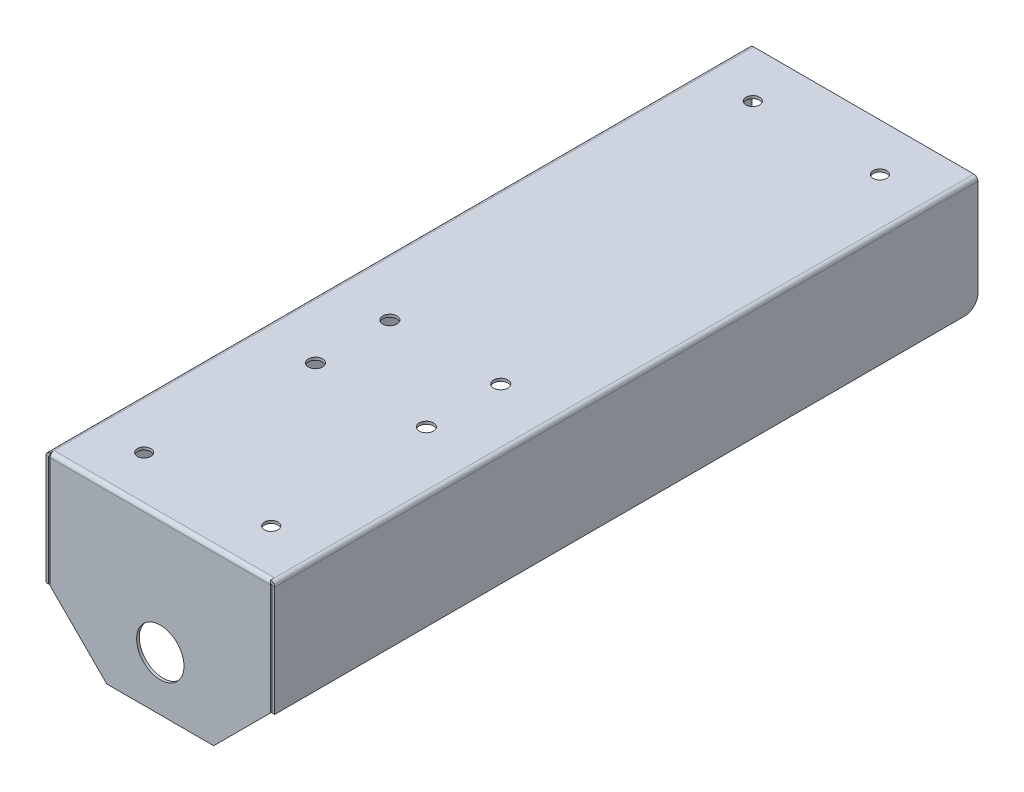
from build123d import *

# Parameters (mm, degrees)
FLANGE_BASE1_DEPTH                 = 520
ESBO_O6_R                          = 5
CORTE_EXTRUS_O4_DEPTH              = 10
ARESTA_FLANGE1_STRIP_W             = 10
ARESTA_FLANGE1_STRIP_H             = 2
ARESTA_FLANGE1_STRIP_CUT_DEPTH     = 163
ARESTA_FLANGE1_DEPTH               = 163
QUEBRA_CANTO1_START                = 518
QUEBRA_CANTO1_DEPTH                = 2
ESBO_O10_R                         = 17.5
CORTE_EXTRUS_O5_DEPTH              = 10
FILETE1_R                          = 10
ESBO_O11_R                         = 5
CORTE_EXTRUS_O6_DEPTH              = 4
FURO_DE_DI_METRO_10_5_10_5_1_D     = 10.5
FURO_DE_DI_METRO_10_5_10_5_1_DEPTH = 11
FURO_DE_DI_METRO_10_5_10_5_1_TIP   = 3.15451825


# Read off the part's stored shape, not the designer's step: Quebra-Canto1
# Sheet-metal steps are written as plain solids
with BuildPart() as part:
    # Esboço1 → Flange-base1 (new body)
    with BuildSketch(Plane.XY):
        with BuildLine():
            Line((-82.5, -44.978989098), (-82.5, 36.521010902))
            ThreePointArc((-82.5, 36.521010902), (-82.207106781, 37.228117683), (-81.5, 37.521010902))
            Line((-81.5, 37.521010902), (81.5, 37.521010902))
            ThreePointArc((81.5, 37.521010902), (82.207106781, 37.228117683), (82.5, 36.521010902))
            Line((82.5, 36.521010902), (82.5, -44.978989098))
            Line((82.5, -44.978989098), (84.5, -44.978989098))
            Line((84.5, -44.978989098), (84.5, 36.521010902))
            ThreePointArc((84.5, 36.521010902), (83.621320344, 38.642331245), (81.5, 39.521010902))
            Line((81.5, 39.521010902), (-81.5, 39.521010902))
            ThreePointArc((-81.5, 39.521010902), (-83.621320344, 38.642331245), (-84.5, 36.521010902))
            Line((-84.5, 36.521010902), (-84.5, -44.978989098))
            Line((-84.5, -44.978989098), (-82.5, -44.978989098))
        make_face()
    extrude(amount=FLANGE_BASE1_DEPTH)

    # Esboço6 → Corte-extrusão4 (cut)
    with BuildSketch(Plane(origin=(0, 39.521010902, 0), x_dir=(1, 0, 0), z_dir=(0, 1, 0))):
        with Locations(Location((47, -485, 0), (0, 0, 180))):
            Circle(ESBO_O6_R)
        with Locations(Location((47, -35, 0), (0, 0, 180))):
            Circle(ESBO_O6_R)
        with Locations((-47, -485)):
            Circle(ESBO_O6_R)
        with Locations((-47, -35)):
            Circle(ESBO_O6_R)
    extrude(amount=-CORTE_EXTRUS_O4_DEPTH, mode=Mode.SUBTRACT)

    # Aresta-Flange1 strip (across the edge) → Aresta-Flange1 strip cut (cut)
    with BuildSketch(Plane(origin=(81.5, 37.521010902, 520), x_dir=(0, 0, -1), z_dir=(-1, 0, 0))):
        with Locations((-2, -1)):
            Rectangle(ARESTA_FLANGE1_STRIP_W, ARESTA_FLANGE1_STRIP_H)
    extrude(amount=ARESTA_FLANGE1_STRIP_CUT_DEPTH, mode=Mode.SUBTRACT)

    # Aresta-Flange1 section (across the edge) → Aresta-Flange1 (add)
    with BuildSketch(Plane(origin=(81.5, 37.521010902, 520), x_dir=(0, 0, -1), z_dir=(-1, 0, 0))):
        with BuildLine():
            Line((0, 1), (0, 125))
            Line((0, 125), (2, 125))
            Line((2, 125), (2, 1))
            ThreePointArc((2, 1), (2.292893219, 0.292893219), (3, 0))
            Line((3, 0), (3, -2))
            ThreePointArc((3, -2), (0.878679656, -1.121320344), (0, 1))
        make_face()
    extrude(amount=ARESTA_FLANGE1_DEPTH)

    # Quebra-Canto1 outline → Quebra-Canto1 (cut)
    with BuildSketch(Plane.XY.offset(QUEBRA_CANTO1_START)):
        Polygon((81.5, -87.478989098), (81.5, -45.478989098), (39.5, -87.478989098), align=None)
        Polygon((-81.5, -87.478989098), (-39.5, -87.478989098), (-81.5, -45.478989098), align=None)
    extrude(amount=QUEBRA_CANTO1_DEPTH, mode=Mode.SUBTRACT)

    # Esboço10 → Corte-extrusão5 (cut)
    with BuildSketch(Plane.XY.offset(520)):
        with Locations((0, -47.478989098)):
            Circle(ESBO_O10_R)
    extrude(amount=-CORTE_EXTRUS_O5_DEPTH, mode=Mode.SUBTRACT)

    # Filete1
    filete1_edges = [part.edges().sort_by_distance(p)[0] for p in [
        (83.5, -44.978989098, 0),
        (-83.5, -44.978989098, 0),
    ]]
    fillet(filete1_edges, radius=FILETE1_R)

    # Esboço11 → Corte-extrusão6 (cut)
    with BuildSketch(Plane.ZY.offset(84.5)):
        with Locations((457, -24.978989098)):
            Circle(ESBO_O11_R)
    extrude(amount=-CORTE_EXTRUS_O6_DEPTH, mode=Mode.SUBTRACT)

    # Furo de diâmetro Ø10.5 (10.5)1
    with Locations(Plane(origin=(-41, 39.521010902, 364.3), x_dir=(1, 0, 0), z_dir=(0, 1, 0))):
        with Locations((0, 0), (82, 0), (82, 55), (0, 55)):
            Hole(FURO_DE_DI_METRO_10_5_10_5_1_D / 2, depth=FURO_DE_DI_METRO_10_5_10_5_1_DEPTH)
            with Locations((0, 0, -(FURO_DE_DI_METRO_10_5_10_5_1_DEPTH + FURO_DE_DI_METRO_10_5_10_5_1_TIP / 2))):  # 118° drill point
                Cone(0, FURO_DE_DI_METRO_10_5_10_5_1_D / 2, FURO_DE_DI_METRO_10_5_10_5_1_TIP, mode=Mode.SUBTRACT)


solid = part.part
